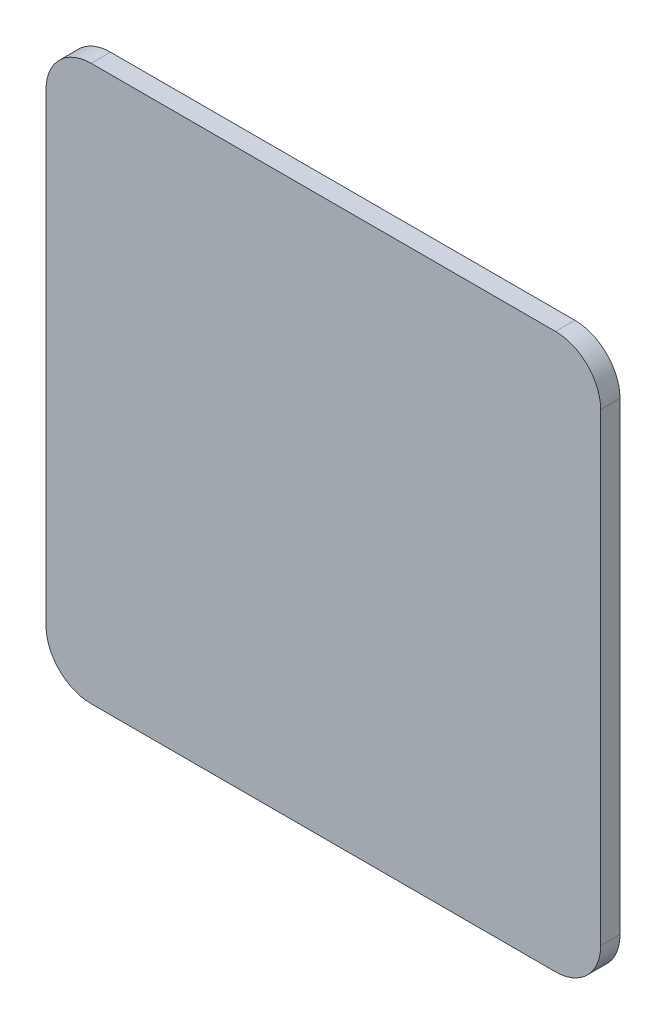
from build123d import *

# Parameters (mm, degrees)
SKETCH1_W           = 86
SKETCH1_H           = 86
BOSS_EXTRUDE1_DEPTH = 3
FILLET1_R           = 7


with BuildPart() as part:
    # Sketch1 → Boss-Extrude1 (new body)
    with BuildSketch(Plane.XY):
        Rectangle(SKETCH1_W, SKETCH1_H)
    extrude(amount=BOSS_EXTRUDE1_DEPTH)

    # Fillet1
    fillet1_edges = [part.edges().sort_by_distance(p)[0] for p in [
        (-43, 43, 1.5),
        (-43, -43, 1.5),
        (43, -43, 1.5),
        (43, 43, 1.5),
    ]]
    fillet(fillet1_edges, radius=FILLET1_R)


solid = part.part
